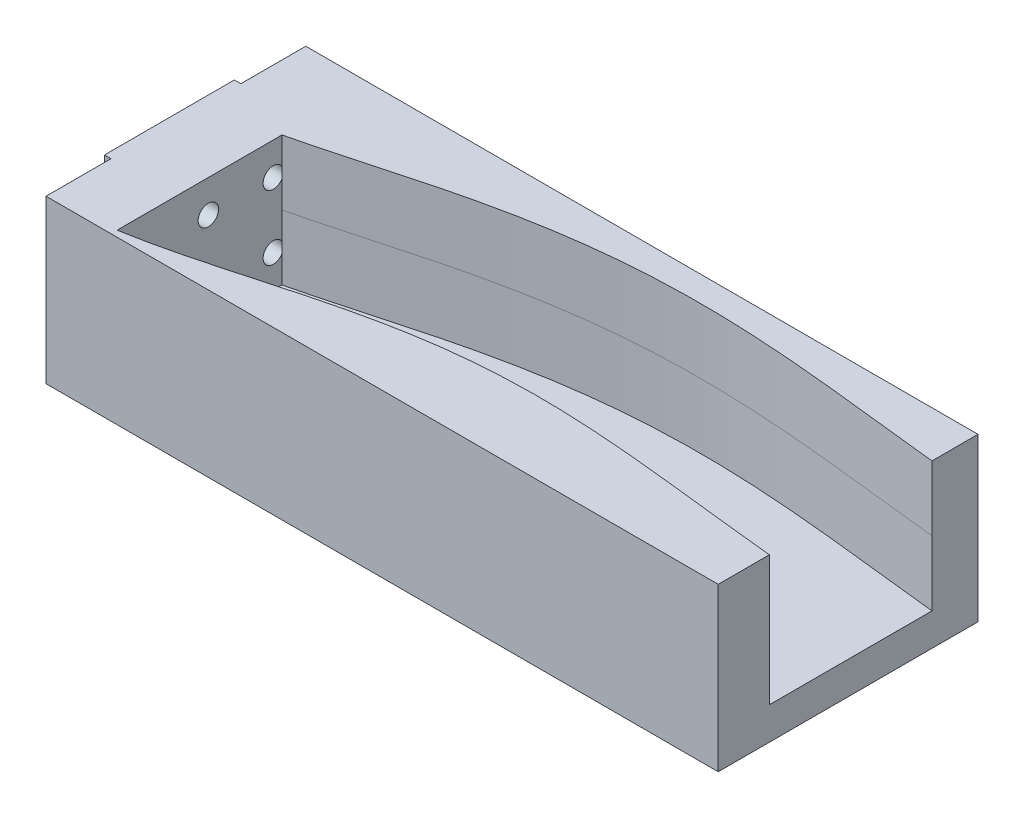
from build123d import *

# Parameters (mm, degrees)
BOSS_EXTRUDE1_DEPTH      = 20
BOSS_EXTRUDE1_DEPTH_BACK = 30
CUT_SWEEP1_START         = -20
CUT_SWEEP1_DEPTH         = 40
SKETCH10_W               = 80
SKETCH10_H               = 50
BOSS_EXTRUDE2_DEPTH      = 20
SKETCH16_W               = 40
SKETCH16_H               = 40
BOSS_EXTRUDE3_DEPTH      = 2
HOLE2_D                  = 6.3
HOLE2_DEPTH              = 22
HOLE2_CBORE_D            = 7.2
HOLE2_CBORE_DEPTH        = 2
SKETCH21_W               = 80
SKETCH21_H               = 50
CUT_EXTRUDE1_DEPTH       = 10


# Read off the part's stored shape, not the designer's step: Cut-Sweep1
with BuildPart() as part:
    # Sketch4 → Boss-Extrude1 (new, two sides: drawn at the far end of the back side and taken through both)
    with BuildSketch(Plane(origin=(0, 0, 0), x_dir=(1, 0, 0), z_dir=(0, 1, 0)).offset(-BOSS_EXTRUDE1_DEPTH_BACK)):
        with BuildLine():
            Line((0, 40.15), (-197, 40.15))
            Line((-197, 40.15), (-197, -12.476031535))
            add(Edge.make_bspline(
                [(-197, -12.476031535), (-157.6, -4.723053252), (-118.2, 15.300441144), (-78.8, 10.012115501), (-39.4, 3.538400001), (0, 0.15)],
                knots=[0.083275556, 0.083275556, 0.083275556, 0.083275556, 0.083275556, 0.083275556, 0.916661414, 0.916661414, 0.916661414, 0.916661414, 0.916661414, 0.916661414], degree=5))
            Line((0, 0.15), (0, 40.15))
        make_face()
        with BuildLine():
            add(Edge.make_bspline(
                [(-197, -12.476031535), (-157.6, -4.723053252), (-118.2, 15.300441144), (-78.8, 10.012115501), (-39.4, 3.538400001), (0, 0.15)],
                knots=[0.083275556, 0.083275556, 0.083275556, 0.083275556, 0.083275556, 0.083275556, 0.916661414, 0.916661414, 0.916661414, 0.916661414, 0.916661414, 0.916661414], degree=5))
            Line((-197, -12.476031535), (-197, -39.85))
            Line((-197, -39.85), (0, -39.85))
            Line((0, -39.85), (0, 0.15))
        make_face()
    extrude(amount=BOSS_EXTRUDE1_DEPTH + BOSS_EXTRUDE1_DEPTH_BACK)

    # Cut-Sweep1 outline → Cut-Sweep1 (cut)
    with BuildSketch(Plane(origin=(0, 0, 0), x_dir=(1, 0, 0), z_dir=(0, 1, 0)).offset(CUT_SWEEP1_START)):
        with BuildLine():
            Line((-197, 12.824466259), (-197, -37.963170516))
            add(Edge.make_bspline(
                [(-197, -37.963170516), (-194.857076562, -37.593469155), (-192.664183232, -37.185688204), (-179.694008515, -34.512721603), (-169.755793181, -31.636726837), (-151.13880736, -26.524050167), (-142.164701345, -24.14456221), (-124.9697813, -20.524403523), (-116.494315107, -19.189461235), (-99.789682062, -17.631352392), (-91.362774073, -17.362930945), (-74.303075644, -17.69764349), (-65.556432968, -18.288800586), (-47.620430646, -19.955725203), (-38.405272349, -21.025808689), (-19.484749512, -23.146908776), (-9.824169485, -24.188286581), (0, -25)],
                knots=[0.098511652, 0.098511652, 0.098511652, 0.098511652, 0.124429736, 0.124429736, 0.248859471, 0.248859471, 0.373289207, 0.373289207, 0.497718942, 0.497718942, 0.622148678, 0.622148678, 0.746578413, 0.746578413, 0.871008149, 0.871008149, 0.995437884, 0.995437884, 0.995437884, 0.995437884], degree=3))
            Line((0, -25), (0, 25))
            add(Edge.make_bspline(
                [(-197, 12.824466259), (-190.953867766, 14.201157707), (-184.535853215, 15.951619244), (-168.3474788, 20.421519224), (-158.563360814, 23.118034358), (-138.248185708, 27.707878723), (-127.968743149, 29.521030359), (-107.155965698, 31.867257342), (-96.8180132, 32.368349134), (-76.327105621, 32.290986848), (-66.286644699, 31.713382561), (-46.616831507, 30.041717947), (-37.012970151, 28.954868939), (-18.255380676, 26.838041894), (-9.05748306, 25.811713394), (0, 25)],
                knots=[0.160277357, 0.160277357, 0.160277357, 0.160277357, 0.248859471, 0.248859471, 0.373289207, 0.373289207, 0.497718942, 0.497718942, 0.622148678, 0.622148678, 0.746578413, 0.746578413, 0.871008149, 0.871008149, 0.995437884, 0.995437884, 0.995437884, 0.995437884], degree=3))
        make_face()
    extrude(amount=CUT_SWEEP1_DEPTH, mode=Mode.SUBTRACT)

    # Sketch10 → Boss-Extrude2 (add)
    with BuildSketch(Plane.ZY.offset(197)):
        with Locations((-0.15, -5)):
            Rectangle(SKETCH10_W, SKETCH10_H)
    extrude(amount=BOSS_EXTRUDE2_DEPTH)

    # Sketch16 → Boss-Extrude3 (add)
    with BuildSketch(Plane.ZY.offset(217)):
        with Locations((-0.15, 0)):
            Rectangle(SKETCH16_W, SKETCH16_H)
    extrude(amount=BOSS_EXTRUDE3_DEPTH)

    # Hole2
    with Locations(Plane.ZY.offset(219)):
        with Locations((-10.15, 10), (9.85, 10), (-10.15, -10), (9.85, -10)):
            CounterBoreHole(HOLE2_D / 2, HOLE2_CBORE_D / 2, HOLE2_CBORE_DEPTH, depth=HOLE2_DEPTH)

    # Sketch21 → Cut-Extrude1 (cut)
    with BuildSketch(Plane(origin=(0, 0, 0), x_dir=(0, 0, -1), z_dir=(1, 0, 0))):
        with Locations((0.15, -5)):
            Rectangle(SKETCH21_W, SKETCH21_H)
    extrude(amount=-CUT_EXTRUDE1_DEPTH, mode=Mode.SUBTRACT)


solid = part.part
